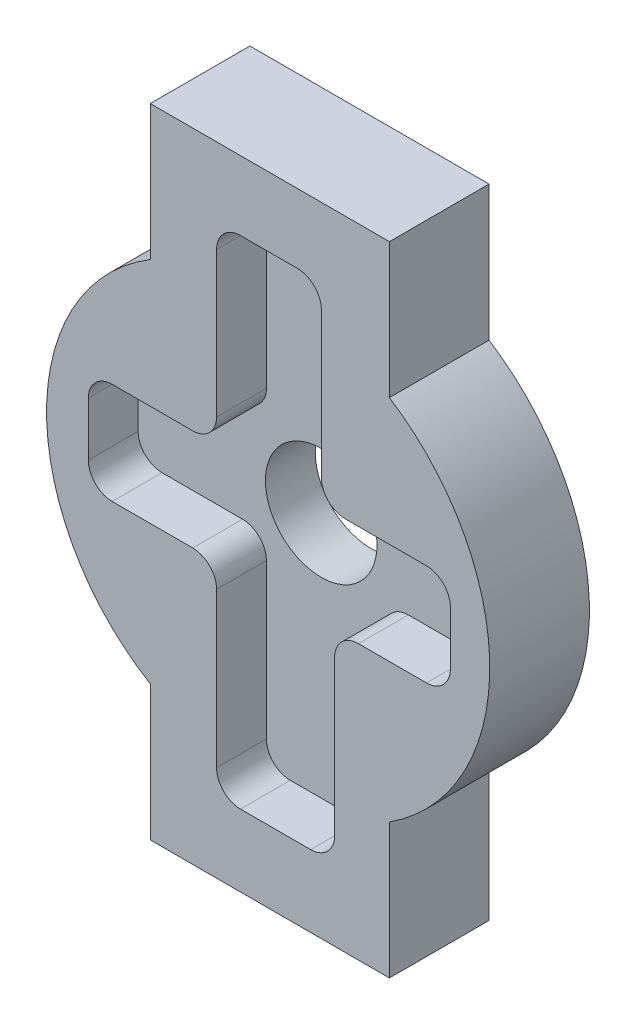
from build123d import *

# Parameters (mm, degrees)
SKETCH1_R           = 2.8
BOSS_EXTRUDE1_DEPTH = 5
CUT_EXTRUDE1_DEPTH  = 2.5
FILLET1_R           = 1.2


with BuildPart() as part:
    # Sketch1 → Boss-Extrude1 (new body)
    with BuildSketch(Plane.XY.offset(10)):
        with BuildLine():
            Line((-253, 240), (-241, 240))
            Line((-241, 240), (-241, 233.219543457))
            ThreePointArc((-241, 233.219543457), (-235.964643127, 224), (-241, 214.780456543))
            Line((-241, 214.780456543), (-241, 208))
            Line((-241, 208), (-253, 208))
            Line((-253, 208), (-253, 214.780456543))
            ThreePointArc((-253, 214.780456543), (-258.20228405, 224), (-253, 233.219543457))
            Line((-253, 233.219543457), (-253, 240))
        make_face()
        with Locations((-246.922635101, 224)):
            Circle(SKETCH1_R, mode=Mode.SUBTRACT)
    extrude(amount=BOSS_EXTRUDE1_DEPTH)

    # Sketch2 → Cut-Extrude1 (cut)
    with BuildSketch(Plane.XY.offset(15)):
        Polygon((-249.671711, 236.526764937), (-244.414971283, 236.526764937), (-244.414971283, 226.843297037), (-237.940881316, 226.843297037), (-237.940881316, 221.752559627), (-243.750962055, 221.752559627), (-243.750962055, 211.604094919), (-249.671711, 211.604094919), (-249.671711, 221.752559627), (-256.108895334, 221.752559627), (-256.108895334, 226.843297037), (-249.671711, 226.843297037), align=None)
    extrude(amount=-CUT_EXTRUDE1_DEPTH, mode=Mode.SUBTRACT)

    # Fillet1
    fillet1_edges = [part.edges().sort_by_distance(p)[0] for p in [
        (-256.108895334, 226.843297037, 13.75),
        (-256.108895334, 221.752559627, 13.75),
        (-249.671711, 221.752559627, 13.75),
        (-249.671711, 211.604094919, 13.75),
        (-243.750962055, 211.604094919, 13.75),
        (-243.750962055, 221.752559627, 13.75),
        (-237.940881316, 221.752559627, 13.75),
        (-237.940881316, 226.843297037, 13.75),
        (-244.414971283, 226.843297037, 13.75),
        (-249.671711, 226.843297037, 13.75),
        (-249.671711, 236.526764937, 13.75),
        (-244.414971283, 236.526764937, 13.75),
    ]]
    fillet(fillet1_edges, radius=FILLET1_R)


solid = part.part
